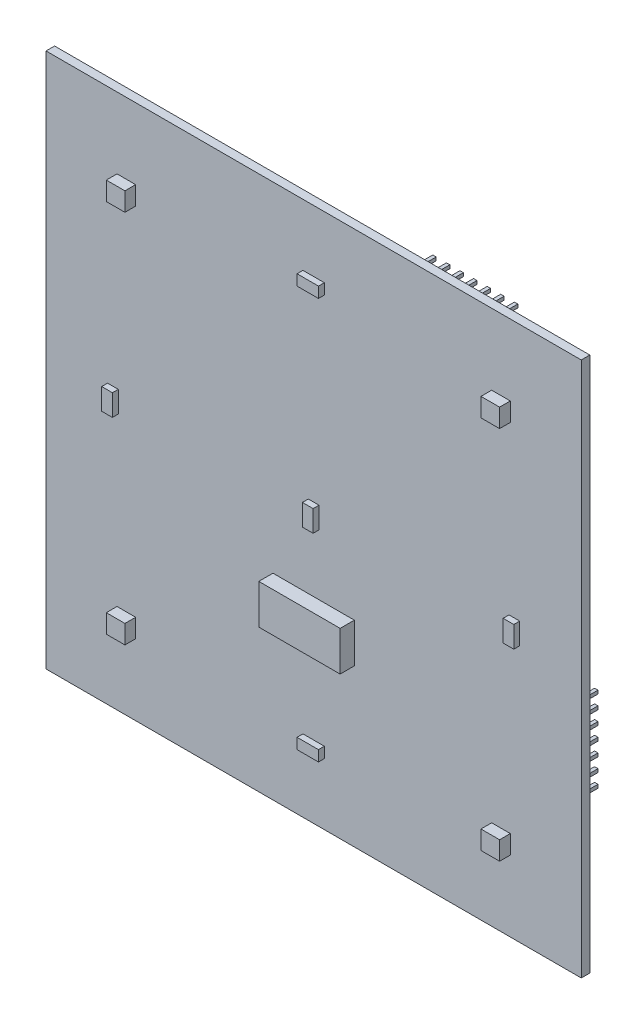
from build123d import *

# Parameters (mm, degrees)
SKETCH_1_W       = 100
SKETCH_1_H       = 100
EXTRUDE_1_DEPTH  = 1.6
SKETCH_4_W       = 17.78
SKETCH_4_H       = 2.5
SKETCH_4_W_2     = 2.5
SKETCH_4_H_2     = 17.78
EXTRUDE_2_DEPTH  = 2.5
SKETCH_5_W       = 0.64
SKETCH_5_H       = 0.64
EXTRUDE_3_DEPTH  = 6.1
SKETCH_6_W       = 3.48
SKETCH_6_H       = 3.48
EXTRUDE_4_DEPTH  = 2
SKETCH_7_W       = 2
SKETCH_7_H       = 4
SKETCH_7_W_2     = 4
SKETCH_7_H_2     = 2
EXTRUDE_5_DEPTH  = 1.1
SKETCH_8_W       = 15.2
SKETCH_8_H       = 7.4
EXTRUDE_6_DEPTH  = 2.65
SKETCH_9_W       = 7.62
SKETCH_9_H       = 2.5
EXTRUDE_7_DEPTH  = 2.5
SKETCH_11_W      = 0.64
SKETCH_11_H      = 0.64
EXTRUDE_8_DEPTH  = 6.1
SKETCH_15_W      = 10.16
SKETCH_15_H      = 2.5
EXTRUDE_11_DEPTH = 2.5
SKETCH_16_W      = 0.64
SKETCH_16_H      = 0.64
EXTRUDE_12_DEPTH = 6.1
EXTRUDE_9_DEPTH  = 6
SKETCH_14_R      = 1
SKETCH_14_W      = 7.62
SKETCH_14_H      = 2.5
SKETCH_14_W_2    = 10.16
EXTRUDE_10_DEPTH = 2


with BuildPart() as part:
    # ｽｹｯﾁ1 → ﾎﾞｽ - 押し出し1 (new body)
    with BuildSketch(Plane.XY):
        Rectangle(SKETCH_1_W, SKETCH_1_H)
    extrude(amount=EXTRUDE_1_DEPTH)

    # ｽｹｯﾁ4 → ﾎﾞｽ - 押し出し2 (add)
    with BuildSketch(Plane(origin=(0, 0, 0), x_dir=(-1, 0, 0), z_dir=(0, 0, -1))):
        with Locations((20, -42.6)):
            Rectangle(SKETCH_4_W, SKETCH_4_H)
        with Locations((-42.6, -20)):
            Rectangle(SKETCH_4_W_2, SKETCH_4_H_2)
        with Locations((-20, 42.6)):
            Rectangle(SKETCH_4_W, SKETCH_4_H)
        with Locations((42.6, 20)):
            Rectangle(SKETCH_4_W_2, SKETCH_4_H_2)
    extrude(amount=EXTRUDE_2_DEPTH)

    # ｽｹｯﾁ5 → ﾎﾞｽ - 押し出し3 (add)
    with BuildSketch(Plane(origin=(0, 0, -2.5), x_dir=(-1, 0, 0), z_dir=(0, 0, -1))):
        with Locations((-20, 42.6)):
            Rectangle(SKETCH_5_W, SKETCH_5_H)
        with Locations((-17.46, 42.6)):
            Rectangle(SKETCH_5_W, SKETCH_5_H)
        with Locations((-14.92, 42.6)):
            Rectangle(SKETCH_5_W, SKETCH_5_H)
        with Locations((-12.38, 42.6)):
            Rectangle(SKETCH_5_W, SKETCH_5_H)
        with Locations((-22.54, 42.6)):
            Rectangle(SKETCH_5_W, SKETCH_5_H)
        with Locations((-25.08, 42.6)):
            Rectangle(SKETCH_5_W, SKETCH_5_H)
        with Locations((-27.62, 42.6)):
            Rectangle(SKETCH_5_W, SKETCH_5_H)
        with Locations((-42.6, -20)):
            Rectangle(SKETCH_5_W, SKETCH_5_H)
        with Locations((-42.6, -22.54)):
            Rectangle(SKETCH_5_W, SKETCH_5_H)
        with Locations((42.6, 20)):
            Rectangle(SKETCH_5_W, SKETCH_5_H)
        with Locations((-42.6, -25.08)):
            Rectangle(SKETCH_5_W, SKETCH_5_H)
        with Locations((-42.6, -27.62)):
            Rectangle(SKETCH_5_W, SKETCH_5_H)
        with Locations((-42.6, -17.46)):
            Rectangle(SKETCH_5_W, SKETCH_5_H)
        with Locations((-42.6, -14.92)):
            Rectangle(SKETCH_5_W, SKETCH_5_H)
        with Locations((-42.6, -12.38)):
            Rectangle(SKETCH_5_W, SKETCH_5_H)
        with Locations((42.6, 17.46)):
            Rectangle(SKETCH_5_W, SKETCH_5_H)
        with Locations((42.6, 14.92)):
            Rectangle(SKETCH_5_W, SKETCH_5_H)
        with Locations((42.6, 12.38)):
            Rectangle(SKETCH_5_W, SKETCH_5_H)
        with Locations((42.6, 22.54)):
            Rectangle(SKETCH_5_W, SKETCH_5_H)
        with Locations((42.6, 25.08)):
            Rectangle(SKETCH_5_W, SKETCH_5_H)
        with Locations((42.6, 27.62)):
            Rectangle(SKETCH_5_W, SKETCH_5_H)
        with Locations((20, -42.6)):
            Rectangle(SKETCH_5_W, SKETCH_5_H)
        with Locations((17.46, -42.6)):
            Rectangle(SKETCH_5_W, SKETCH_5_H)
        with Locations((14.92, -42.6)):
            Rectangle(SKETCH_5_W, SKETCH_5_H)
        with Locations((12.38, -42.6)):
            Rectangle(SKETCH_5_W, SKETCH_5_H)
        with Locations((22.54, -42.6)):
            Rectangle(SKETCH_5_W, SKETCH_5_H)
        with Locations((25.08, -42.6)):
            Rectangle(SKETCH_5_W, SKETCH_5_H)
        with Locations((27.62, -42.6)):
            Rectangle(SKETCH_5_W, SKETCH_5_H)
    extrude(amount=EXTRUDE_3_DEPTH)

    # ｽｹｯﾁ6 → ﾎﾞｽ - 押し出し4 (add)
    with BuildSketch(Plane.XY.offset(1.6)):
        with Locations((-35, -35)):
            Rectangle(SKETCH_6_W, SKETCH_6_H)
        with Locations((-35, 35)):
            Rectangle(SKETCH_6_W, SKETCH_6_H)
        with Locations((35, -35)):
            Rectangle(SKETCH_6_W, SKETCH_6_H)
        with Locations((35, 35)):
            Rectangle(SKETCH_6_W, SKETCH_6_H)
    extrude(amount=EXTRUDE_4_DEPTH)

    # ｽｹｯﾁ7 → ﾎﾞｽ - 押し出し5 (add)
    with BuildSketch(Plane.XY.offset(1.6)):
        with Locations((-37.5, 0)):
            Rectangle(SKETCH_7_W, SKETCH_7_H)
        with Locations((37.5, 0)):
            Rectangle(SKETCH_7_W, SKETCH_7_H)
        with Locations((0, 37.5)):
            Rectangle(SKETCH_7_W_2, SKETCH_7_H_2)
        with Locations((0, -37.5)):
            Rectangle(SKETCH_7_W_2, SKETCH_7_H_2)
        Rectangle(SKETCH_7_W, SKETCH_7_H)
    extrude(amount=EXTRUDE_5_DEPTH)

    # ｽｹｯﾁ8 → ﾎﾞｽ - 押し出し6 (add)
    with BuildSketch(Plane.XY.offset(1.6)):
        with Locations((0, -17)):
            Rectangle(SKETCH_8_W, SKETCH_8_H)
    extrude(amount=EXTRUDE_6_DEPTH)

    # ｽｹｯﾁ9 → ﾎﾞｽ - 押し出し7 (add)
    with BuildSketch(Plane(origin=(0, 0, 0), x_dir=(-1, 0, 0), z_dir=(0, 0, -1))):
        with Locations((-0.8, 18.58)):
            Rectangle(SKETCH_9_W, SKETCH_9_H)
    extrude(amount=EXTRUDE_7_DEPTH)

    # ｽｹｯﾁ11 → ﾎﾞｽ - 押し出し8 (add)
    with BuildSketch(Plane(origin=(0, 0, -2.5), x_dir=(-1, 0, 0), z_dir=(0, 0, -1))):
        with Locations((-0.8, 18.58)):
            Rectangle(SKETCH_11_W, SKETCH_11_H)
        with Locations((-3.34, 18.58)):
            Rectangle(SKETCH_11_W, SKETCH_11_H)
        with Locations((1.74, 18.58)):
            Rectangle(SKETCH_11_W, SKETCH_11_H)
    extrude(amount=EXTRUDE_8_DEPTH)

    # ｽｹｯﾁ15 → ﾎﾞｽ - 押し出し11 (add)
    with BuildSketch(Plane(origin=(0, 0, 0), x_dir=(-1, 0, 0), z_dir=(0, 0, -1))):
        with Locations((0, -31)):
            Rectangle(SKETCH_15_W, SKETCH_15_H)
    extrude(amount=EXTRUDE_11_DEPTH)

    # ｽｹｯﾁ16 → ﾎﾞｽ - 押し出し12 (add)
    with BuildSketch(Plane(origin=(0, 0, -2.5), x_dir=(-1, 0, 0), z_dir=(0, 0, -1))):
        with Locations((-3.81, -31)):
            Rectangle(SKETCH_16_W, SKETCH_16_H)
        with Locations((-1.27, -31)):
            Rectangle(SKETCH_16_W, SKETCH_16_H)
        with Locations((1.27, -31)):
            Rectangle(SKETCH_16_W, SKETCH_16_H)
        with Locations((3.81, -31)):
            Rectangle(SKETCH_16_W, SKETCH_16_H)
    extrude(amount=EXTRUDE_12_DEPTH)

    # ｽｹｯﾁ13 → ﾎﾞｽ - 押し出し9 (add)
    with BuildSketch(Plane(origin=(0, 0, 0), x_dir=(-1, 0, 0), z_dir=(0, 0, -1))):
        Polygon((32, -30), (31, -28.267949192), (29, -28.267949192), (28, -30), (29, -31.732050808), (31, -31.732050808), align=None)
        Polygon((-28, -30), (-29, -28.267949192), (-31, -28.267949192), (-32, -30), (-31, -31.732050808), (-29, -31.732050808), align=None)
        Polygon((32, 30), (31, 31.732050808), (29, 31.732050808), (28, 30), (29, 28.267949192), (31, 28.267949192), align=None)
        Polygon((-28, 30), (-29, 31.732050808), (-31, 31.732050808), (-32, 30), (-31, 28.267949192), (-29, 28.267949192), align=None)
    extrude(amount=EXTRUDE_9_DEPTH)


with BuildPart() as body_2:
    # ｽｹｯﾁ14 → ﾎﾞｽ - 押し出し10 (new body)
    with BuildSketch(Plane(origin=(0, 0, -6), x_dir=(-1, 0, 0), z_dir=(0, 0, -1))):
        Polygon((0, -39), (0, -41), (39, -41), (39, 0), (41, 0), (41, 39), (0, 39), (0, 41), (-39, 41), (-39, 0), (-41, 0), (-41, -39), align=None)
        with Locations((-30, 30)):
            Circle(SKETCH_14_R, mode=Mode.SUBTRACT)
        with Locations((30, 30)):
            Circle(SKETCH_14_R, mode=Mode.SUBTRACT)
        with Locations((30, -30)):
            Circle(SKETCH_14_R, mode=Mode.SUBTRACT)
        with Locations((-30, -30)):
            Circle(SKETCH_14_R, mode=Mode.SUBTRACT)
        with Locations((-0.8, 18.58)):
            Rectangle(SKETCH_14_W, SKETCH_14_H, mode=Mode.SUBTRACT)
        with Locations((0, -31)):
            Rectangle(SKETCH_14_W_2, SKETCH_14_H, mode=Mode.SUBTRACT)
    extrude(amount=EXTRUDE_10_DEPTH)


solid = Compound([part.part, body_2.part])
